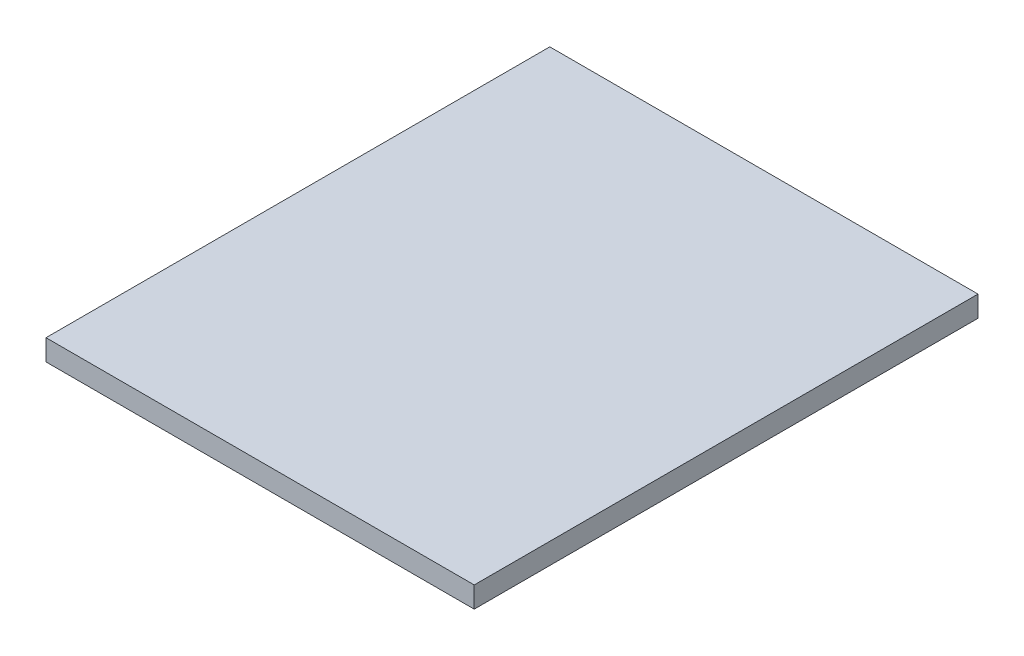
from build123d import *

# Parameters (mm, degrees)
SKETCH1_W           = 102
SKETCH1_H           = 120
BOSS_EXTRUDE1_DEPTH = 5


with BuildPart() as part:
    # Sketch1 → Boss-Extrude1 (new body)
    with BuildSketch(Plane(origin=(0, 0, 0), x_dir=(1, 0, 0), z_dir=(0, 1, 0))):
        Rectangle(SKETCH1_W, SKETCH1_H)
    extrude(amount=BOSS_EXTRUDE1_DEPTH)


solid = part.part
